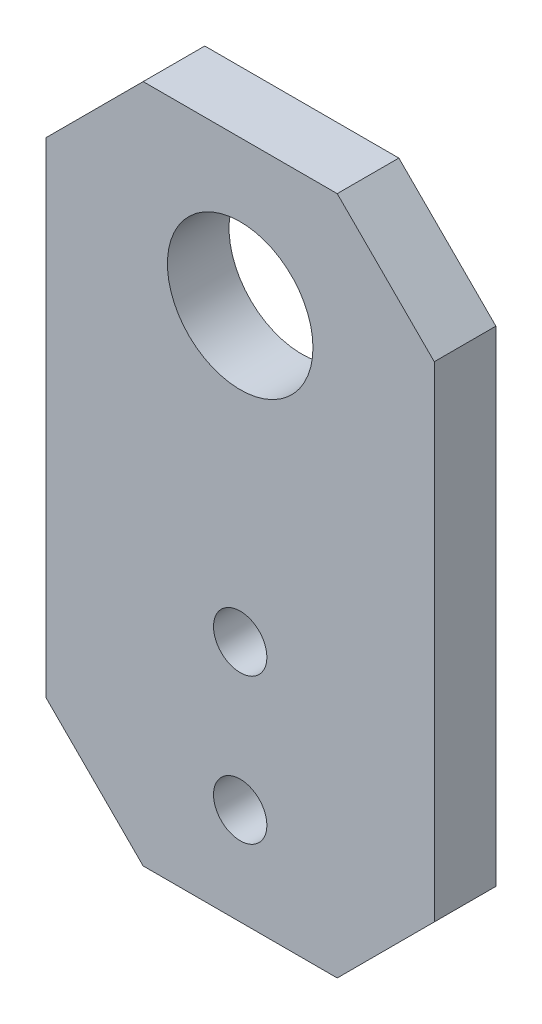
from build123d import *

# Parameters (mm, degrees)
SKETCH1_W            = 40
SKETCH1_H            = 70
SKETCH1_R            = 7.5
BOSS_EXTRUDE1_DEPTH  = 6.35
M5_CLEARANCE_HOLE1_D = 5.5
CHAMFER1_SIZE        = 10


with BuildPart() as part:
    # Sketch1 → Boss-Extrude1 (new body)
    with BuildSketch(Plane.XY):
        Rectangle(SKETCH1_W, SKETCH1_H)
        with Locations((0, 20)):
            Circle(SKETCH1_R, mode=Mode.SUBTRACT)
    extrude(amount=BOSS_EXTRUDE1_DEPTH)

    # M5 Clearance Hole1 (through all)
    with Locations(Plane.XY.offset(6.35)):
        with Locations((0, -10), (0, -25)):
            Hole(M5_CLEARANCE_HOLE1_D / 2)

    # Chamfer1
    chamfer1_edges = [part.edges().sort_by_distance(p)[0] for p in [
        (20, -35, 3.175),
        (-20, -35, 3.175),
        (20, 35, 3.175),
        (-20, 35, 3.175),
    ]]
    chamfer(chamfer1_edges, length=CHAMFER1_SIZE)


solid = part.part
